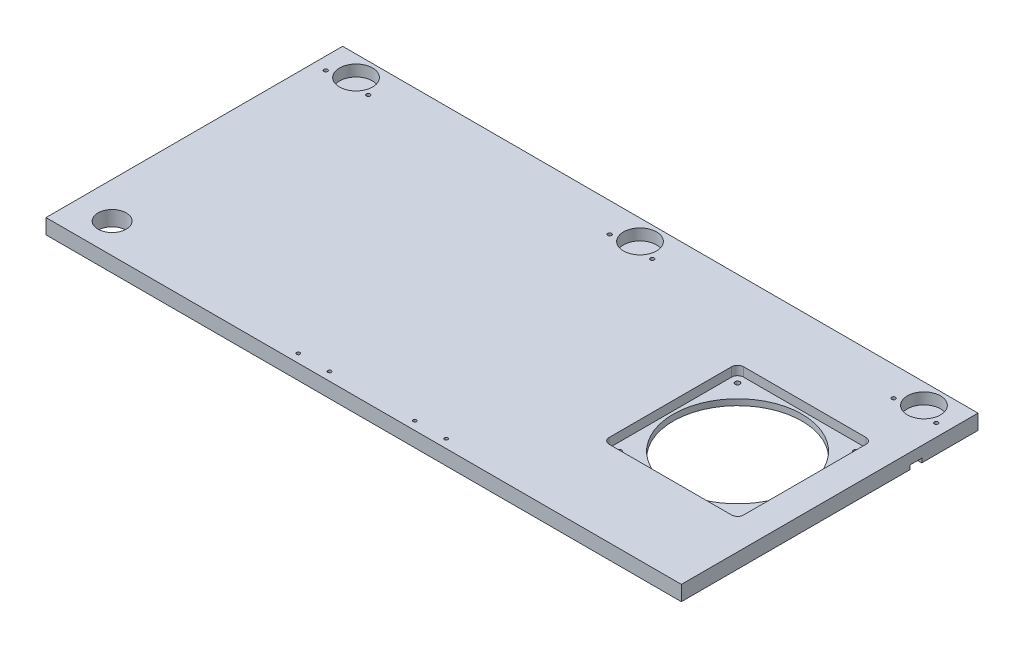
from build123d import *

# Parameters (mm, degrees)
SKETCH1_W               = 671.2712
SKETCH1_H               = 313.4106
BOSS_EXTRUDE1_DEPTH     = 15.875
CUT_EXTRUDE2_DEPTH      = 371.755745283
CUT_EXTRUDE2_DEPTH_BACK = 371.755745283
SKETCH4_R               = 14.9225
SKETCH5_R               = 17.4625
SKETCH5_R_2             = 2
CUT_EXTRUDE3_DEPTH      = 11.90625
SKETCH6_R               = 1.8
CUT_EXTRUDE4_DEPTH      = 2.54
CUT_EXTRUDE5_DEPTH      = 371.755745283
CUT_EXTRUDE5_DEPTH_BACK = 371.755745283
SKETCH7_R               = 68
SKETCH7_R_2             = 2.54
CUT_EXTRUDE6_DEPTH      = 9.525
SKETCH9_W               = 671.2712
SKETCH9_H               = 12.5
CUT_EXTRUDE7_DEPTH      = 4.35


with BuildPart() as part:
    # Sketch1 → Boss-Extrude1 (new body)
    with BuildSketch(Plane(origin=(0, 0, 0), x_dir=(1, 0, 0), z_dir=(0, 1, 0))):
        Rectangle(SKETCH1_W, SKETCH1_H)
    extrude(amount=BOSS_EXTRUDE1_DEPTH)

    # Sketch4 → Cut-Extrude2 (cut, two sides: drawn at the far end of the back side and taken through both)
    with BuildSketch(Plane(origin=(0, 15.875, 0), x_dir=(1, 0, 0), z_dir=(0, 1, 0)).offset(-CUT_EXTRUDE2_DEPTH_BACK)):
        with Locations((-297.5356, -124.9553)):
            Circle(SKETCH4_R)
    extrude(amount=CUT_EXTRUDE2_DEPTH + CUT_EXTRUDE2_DEPTH_BACK, mode=Mode.SUBTRACT)

    # Sketch5 → Cut-Extrude3 (cut)
    with BuildSketch(Plane(origin=(0, 15.875, 0), x_dir=(1, 0, 0), z_dir=(0, 1, 0))):
        with Locations((0, 135.2428)):
            Circle(SKETCH5_R)
        with Locations((22.5, 125.7428)):
            Circle(SKETCH5_R_2)
        with Locations((-22.5, 125.7428)):
            Circle(SKETCH5_R_2)
        with Locations((-300, 135.2428)):
            Circle(SKETCH5_R)
        with Locations((-277.5, 125.7428)):
            Circle(SKETCH5_R_2)
        with Locations((-322.5, 125.7428)):
            Circle(SKETCH5_R_2)
        with Locations((322.5, 125.7428)):
            Circle(SKETCH5_R_2)
        with Locations((277.5, 125.7428)):
            Circle(SKETCH5_R_2)
        with Locations((300, 135.2428)):
            Circle(SKETCH5_R)
    extrude(amount=-CUT_EXTRUDE3_DEPTH, mode=Mode.SUBTRACT)

    # Sketch6 → Cut-Extrude4 (cut)
    with BuildSketch(Plane(origin=(0, 15.875, 0), x_dir=(1, 0, 0), z_dir=(0, 1, 0))):
        with Locations((78.0499912, -147.7053)):
            Circle(SKETCH6_R)
        with Locations((45.0499912, -147.7053)):
            Circle(SKETCH6_R)
        with Locations((-45.0499912, -147.7053)):
            Circle(SKETCH6_R)
        with Locations((-78.0499912, -147.7053)):
            Circle(SKETCH6_R)
    extrude(amount=-CUT_EXTRUDE4_DEPTH, mode=Mode.SUBTRACT)

    # Sketch7 → Cut-Extrude5 (cut, two sides: drawn at the far end of the back side and taken through both)
    with BuildSketch(Plane(origin=(0, 15.875, 0), x_dir=(1, 0, 0), z_dir=(0, 1, 0)).offset(-CUT_EXTRUDE5_DEPTH_BACK)):
        with Locations((234.0356, 4.3053)):
            Circle(SKETCH7_R)
        with Locations((296.5356, -58.1947)):
            Circle(SKETCH7_R_2)
        with Locations((296.5356, 66.8053)):
            Circle(SKETCH7_R_2)
        with Locations((171.5356, 66.8053)):
            Circle(SKETCH7_R_2)
        with Locations((171.5356, -58.1947)):
            Circle(SKETCH7_R_2)
    extrude(amount=CUT_EXTRUDE5_DEPTH + CUT_EXTRUDE5_DEPTH_BACK, mode=Mode.SUBTRACT)

    # Sketch8 → Cut-Extrude6 (cut)
    with BuildSketch(Plane(origin=(0, 15.875, 0), x_dir=(1, 0, 0), z_dir=(0, 1, 0))):
        with BuildLine():
            Line((169.3856, -66.6947), (298.6856, -66.6947))
            ThreePointArc((298.6856, -66.6947), (303.175728061, -64.834828061), (305.0356, -60.3447))
            Line((305.0356, -60.3447), (305.0356, 68.9553))
            ThreePointArc((305.0356, 68.9553), (303.175728061, 73.445428061), (298.6856, 75.3053))
            Line((298.6856, 75.3053), (169.3856, 75.3053))
            ThreePointArc((169.3856, 75.3053), (164.895471939, 73.445428061), (163.0356, 68.9553))
            Line((163.0356, 68.9553), (163.0356, -60.3447))
            ThreePointArc((163.0356, -60.3447), (164.895471939, -64.834828061), (169.3856, -66.6947))
        make_face()
    extrude(amount=-CUT_EXTRUDE6_DEPTH, mode=Mode.SUBTRACT)

    # Sketch9 → Cut-Extrude7 (cut)
    with BuildSketch(Plane.XZ):
        with Locations((0, -91.0447)):
            Rectangle(SKETCH9_W, SKETCH9_H)
    extrude(amount=-CUT_EXTRUDE7_DEPTH, mode=Mode.SUBTRACT)


solid = part.part
